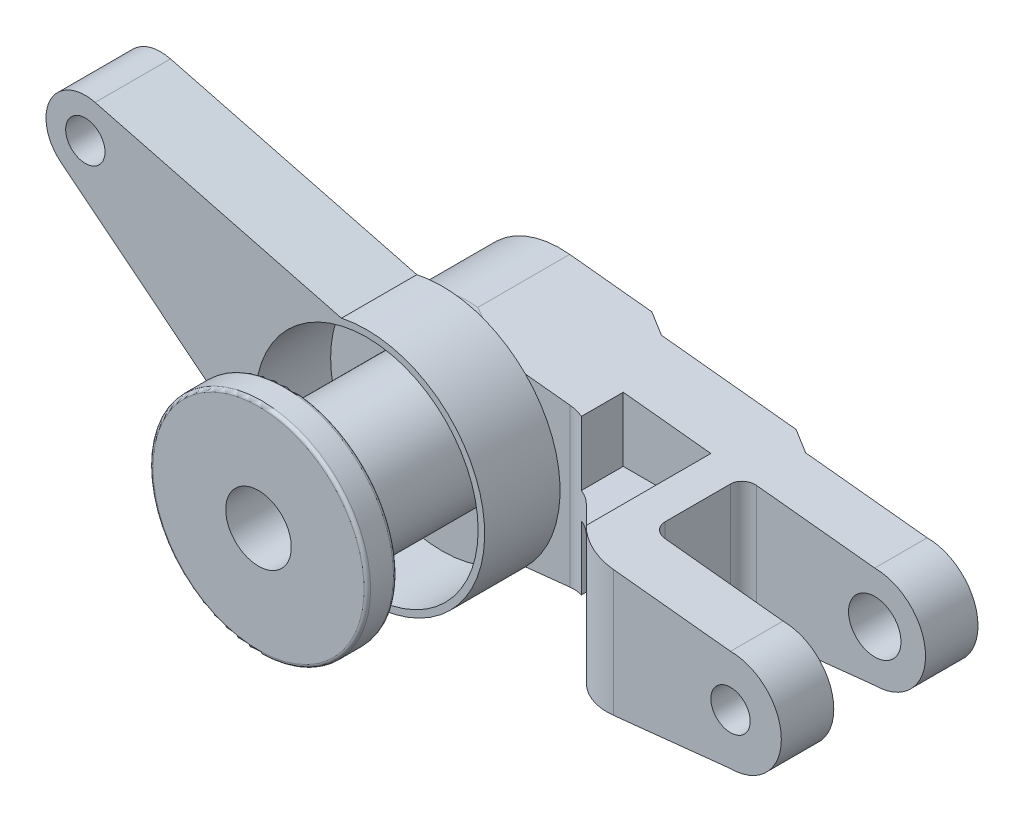
from build123d import *

# Parameters (mm, degrees)
SKETCH1_R                = 7
SKETCH1_R_2              = 3.5
CYLINDER_DEPTH           = 22.85
SKETCH2_R                = 4
BORE_1_DEPTH             = 3.25
BORE_START               = -3.25
SKETCH3_R                = 4
BORE_2_DEPTH             = 3.25
ARM_DEPTH                = 17
SKETCH5_R                = 3.5
OUTER_HOLE_SURFACE_DEPTH = 6
SKETCH6_R                = 1.125
OUTER_HOLE_DEPTH         = 6
SIDE_FEATURES_DEPTH      = 22
RIB_START                = -11
SKETCH10_W               = 6.681980515
SKETCH10_H               = 4.897943925
RIB_DEPTH                = 9.5
SKETCH13_R               = 1.5
BOTTOM_HOLE_DEPTH        = 4
MODIFY_START             = -17
SKETCH14_W               = 14
SKETCH14_H               = 13.85
MODIFY_1ST_POST_DEPTH    = 14
SKETCH16_R               = 8.5
SKETCH16_R_2             = 1.5
ARM_2_DEPTH              = 5.75


# Read off the part's stored shape, not the designer's step: Top Counter-sunk
with BuildPart() as part:
    # Sketch1 → Cylinder (new body)
    with BuildSketch(Plane.XY):
        with Locations(Location((0, 0, 0), (0, 0, 180))):
            Circle(SKETCH1_R)
        with Locations(Location((0, 0, 0), (0, 0, 180))):
            Circle(SKETCH1_R_2, mode=Mode.SUBTRACT)
    extrude(amount=CYLINDER_DEPTH)

    # Sketch2 → Bore 1 (cut)
    with BuildSketch(Plane.XY.offset(22.85)):
        Circle(SKETCH2_R)
    extrude(amount=-BORE_1_DEPTH, mode=Mode.SUBTRACT)

    # Sketch3 → Bore 2 (cut)
    with BuildSketch(Plane(origin=(0, 0, 0), x_dir=(-1, 0, 0), z_dir=(0, 0, -1)).offset(BORE_START)):
        with Locations(Location((0, 0, 0), (0, 0, 180))):
            Circle(SKETCH3_R)
    extrude(amount=BORE_2_DEPTH, mode=Mode.SUBTRACT)

    # Sketch4 → Arm (add)
    with BuildSketch(Plane.XY):
        with BuildLine():
            Line((0.734153157, 6.961394914), (30, 3.875))
            ThreePointArc((30, 3.875), (33.875, 0), (30, -3.875))
            Line((30, -3.875), (0.734153157, -6.961394914))
            ThreePointArc((0.734153157, -6.961394914), (7, 0), (0.734153157, 6.961394914))
        make_face()
    extrude(amount=ARM_DEPTH)

    # Sketch5 → Outer Hole surface (add)
    with BuildSketch(Plane(origin=(0, 0, 0), x_dir=(-1, 0, 0), z_dir=(0, 0, -1))):
        with Locations((-14, -6)):
            Circle(SKETCH5_R)
    extrude(amount=-OUTER_HOLE_SURFACE_DEPTH)

    # Sketch6 → Outer hole (cut)
    with BuildSketch(Plane(origin=(0, 0, 0), x_dir=(-1, 0, 0), z_dir=(0, 0, -1))):
        with Locations((-14, -6)):
            Circle(SKETCH6_R)
    extrude(amount=-OUTER_HOLE_DEPTH, mode=Mode.SUBTRACT)

    # Sketch8 → side Features (cut)
    with BuildSketch(Plane(origin=(0, 10, 0), x_dir=(1, 0, 0), z_dir=(0, 1, 0))):
        with BuildLine():
            Line((21, -6), (40, -6))
            Line((40, -6), (40, -13))
            Line((40, -13), (21, -13))
            ThreePointArc((21, -13), (20.292893219, -12.707106781), (20, -12))
            Line((20, -12), (20, -7))
            ThreePointArc((20, -7), (20.292893219, -6.292893219), (21, -6))
        make_face()
        with BuildLine():
            Line((7, -19), (7, -9))
            Line((7, -9), (9.757359313, -9))
            ThreePointArc((9.757359313, -9), (10.90540961, -9.228361402), (11.878679656, -9.878679656))
            Line((11.878679656, -9.878679656), (17.535533906, -15.535533906))
            ThreePointArc((17.535533906, -15.535533906), (19.15765065, -16.619397663), (21.071067812, -17))
            Line((21.071067812, -17), (27, -17))
            Line((27, -17), (27, -19))
            Line((27, -19), (7, -19))
        make_face()
        Polygon((7, 0), (8.732050808, -1), (19, -1), (20.732050808, -2), (40, -2), (40, 0), align=None)
    extrude(amount=-SIDE_FEATURES_DEPTH, mode=Mode.SUBTRACT)

    # Sketch10 → Rib (cut)
    with BuildSketch(Plane.XY.offset(17).offset(RIB_START)):
        with Locations((14.159009743, 3.448971963)):
            Rectangle(SKETCH10_W, SKETCH10_H)
        with Locations((14.159009743, -3.448971963)):
            Rectangle(SKETCH10_W, SKETCH10_H)
    extrude(amount=RIB_DEPTH, mode=Mode.SUBTRACT)

    # Top Counter-sunk outline → Top Counter-sunk (revolve, cut)
    with BuildSketch(Plane(origin=(30, 0, 0), x_dir=(1, 0, 0), z_dir=(0, -1, 0))):
        Polygon((2, 3.150368407), (2, 6), (0, 6), (0, 2), (3, 2), align=None)
    revolve(axis=Axis((30, 0, 0), (0, 0, 1)), mode=Mode.SUBTRACT)

    # Sketch13 → Bottom hole (cut)
    with BuildSketch(Plane.XY.offset(17)):
        with Locations((30, 0)):
            Circle(SKETCH13_R)
    extrude(amount=-BOTTOM_HOLE_DEPTH, mode=Mode.SUBTRACT)

    # Sketch14 → Modify 1st Post (cut)
    with BuildSketch(Plane(origin=(0, 10, 0), x_dir=(1, 0, 0), z_dir=(0, 1, 0)).offset(MODIFY_START)):
        with Locations((0, -15.925)):
            Rectangle(SKETCH14_W, SKETCH14_H)
    extrude(amount=MODIFY_1ST_POST_DEPTH, mode=Mode.SUBTRACT)

    # Sketch16 → Arm 2 (add)
    with BuildSketch(Plane.XY.offset(9)):
        with BuildLine():
            Line((-1.923786579, 8.791987557), (-20.708474673, 13.650638528))
            ThreePointArc((-20.708474673, 13.650638528), (-24.142164395, 12.089495372), (-23.335359521, 8.404870702))
            Line((-23.335359521, 8.404870702), (-8.192413809, -3.726171759))
            ThreePointArc((-8.192413809, -3.726171759), (8.047388132, -4.029831791), (-1.923786579, 8.791987557))
        make_face()
        with Locations(Location((0, 0, 0), (0, 0, 49.419481648))):
            Circle(SKETCH16_R, mode=Mode.SUBTRACT)
        with Locations((-21.459701684, 10.746218108)):
            Circle(SKETCH16_R_2, mode=Mode.SUBTRACT)
    extrude(amount=ARM_2_DEPTH)

    # Sketch18 → Connect Arm 2 (revolve)
    with BuildSketch(Plane(origin=(0, 0, 0), x_dir=(1, 0, 0), z_dir=(0, 1, 0))):
        with BuildLine():
            Line((-7, -7), (-7, -9))
            Line((-7, -9), (-9, -9))
            ThreePointArc((-9, -9), (-7.585786438, -8.414213562), (-7, -7))
        make_face()
    revolve(axis=Axis((0, 0, -2.563667384), (0, 0, 1)))


with BuildPart() as body_2:
    # Sketch19 → Base (revolve)
    with BuildSketch(Plane(origin=(0, 0, 0), x_dir=(1, 0, 0), z_dir=(0, 1, 0))):
        with BuildLine():
            Line((-4.9, -9), (-4.9, -20.5))
            ThreePointArc((-4.9, -20.5), (-4.973223305, -20.676776695), (-5.15, -20.75))
            Line((-5.15, -20.75), (-8.05, -20.75))
            ThreePointArc((-8.05, -20.75), (-8.226776695, -20.823223305), (-8.3, -21))
            Line((-8.3, -21), (-8.3, -22.75))
            ThreePointArc((-8.3, -22.75), (-8.226776695, -22.926776695), (-8.05, -23))
            Line((-8.05, -23), (-2.5, -23))
            Line((-2.5, -23), (-2.5, -9))
            Line((-2.5, -9), (-4.9, -9))
        make_face()
    revolve(axis=Axis((0, 0, -4.336156577), (0, 0, 1)))


solid = Compound([part.part, body_2.part])
